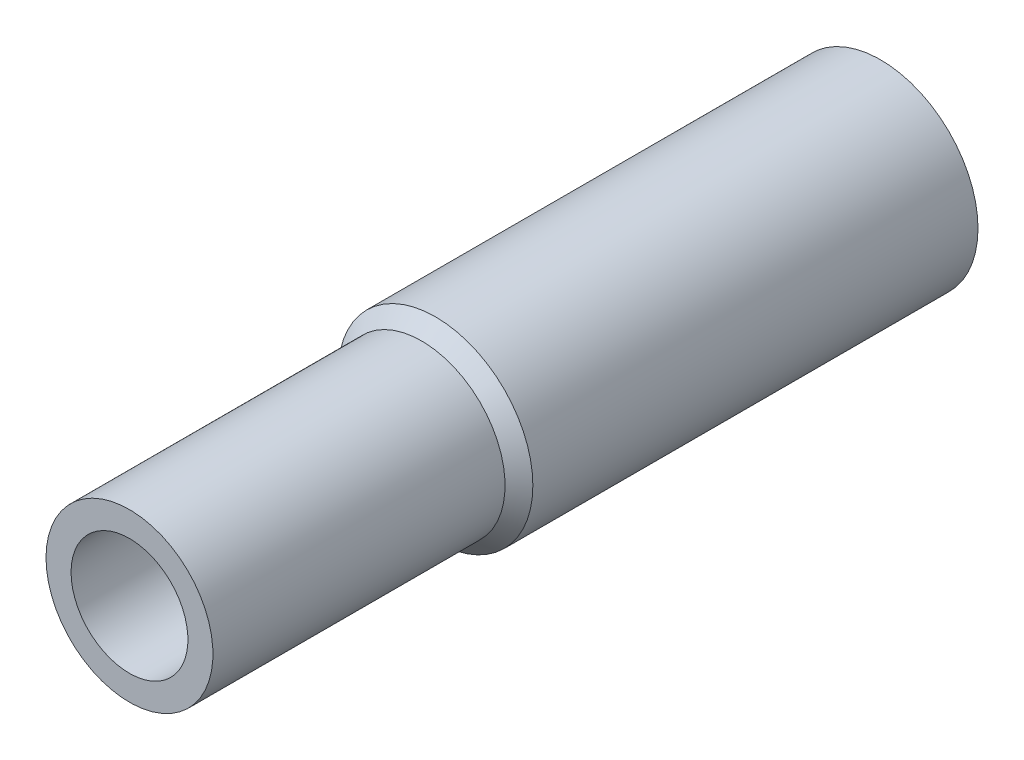
from build123d import *

# Parameters (mm, degrees)
SKETCH1_R                                       = 3.5
BOSS_EXTRUDE1_DEPTH                             = 16.5
CHAMFER1_SIZE                                   = 0.5
SKETCH2_R                                       = 3
BOSS_EXTRUDE2_DEPTH                             = 10.5
CSK_FOR_M4_FLAT_HEAD_MACHINE_SCREW1_D           = 4.2
CSK_FOR_M4_FLAT_HEAD_MACHINE_SCREW1_CSINK_D     = 5.5
CSK_FOR_M4_FLAT_HEAD_MACHINE_SCREW1_CSINK_ANGLE = 90


with BuildPart() as part:
    # Sketch1 → Boss-Extrude1 (new body)
    with BuildSketch(Plane.XY):
        Circle(SKETCH1_R)
    extrude(amount=BOSS_EXTRUDE1_DEPTH)

    # Chamfer1
    chamfer1_edges = [part.edges().sort_by_distance(p)[0] for p in [
        (-3.5, 0, 16.5),
    ]]
    chamfer(chamfer1_edges, length=CHAMFER1_SIZE)

    # Sketch2 → Boss-Extrude2 (add)
    with BuildSketch(Plane.XY.offset(16.5)):
        Circle(SKETCH2_R)
    extrude(amount=BOSS_EXTRUDE2_DEPTH)

    # CSK for M4 Flat Head Machine Screw1 (through all)
    with Locations(Plane(origin=(0, 0, 0), x_dir=(-1, 0, 0), z_dir=(0, 0, -1))):
        with Locations((0, 0)):
            CounterSinkHole(CSK_FOR_M4_FLAT_HEAD_MACHINE_SCREW1_D / 2, CSK_FOR_M4_FLAT_HEAD_MACHINE_SCREW1_CSINK_D / 2, counter_sink_angle=CSK_FOR_M4_FLAT_HEAD_MACHINE_SCREW1_CSINK_ANGLE)


solid = part.part
